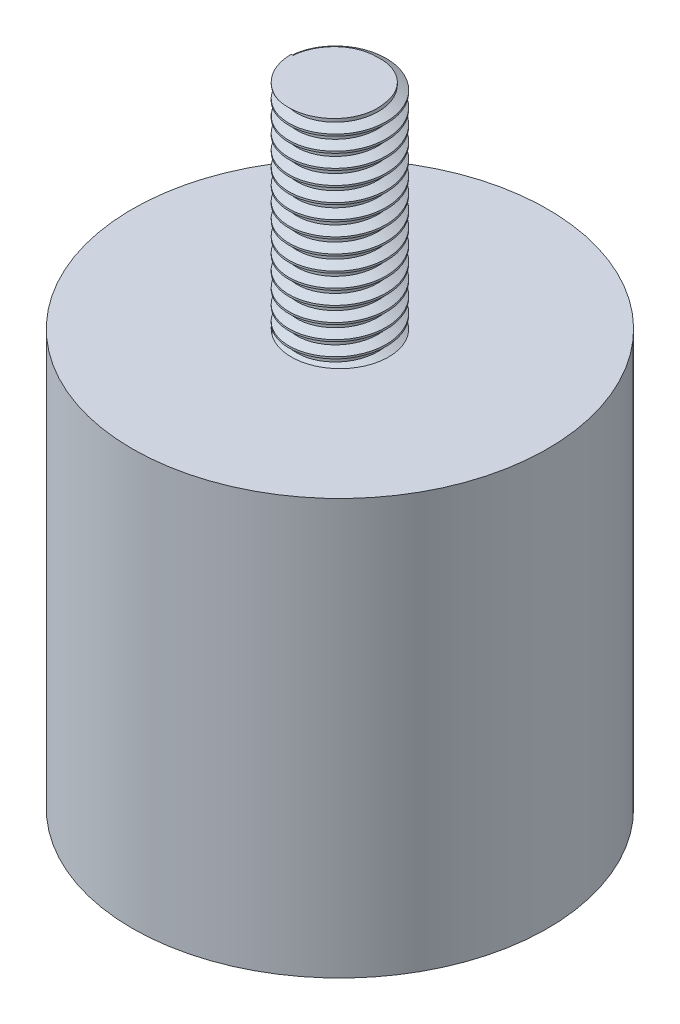
from build123d import *

# Parameters (mm, degrees)
IZIM2_W                     = 17.5
IZIM2_H                     = 35
IZIM2_W_2                   = 4.1
IZIM2_H_2                   = 18
DI_1_PITCH                  = 1.25
M8_DI_LI_DELIK1_D           = 6.8
M8_DI_LI_DELIK1_DEPTH       = 15
M8_DI_LI_DELIK1_CSINK_D     = 8.05
M8_DI_LI_DELIK1_CSINK_ANGLE = 90
M8_DI_LI_DELIK1_TIP         = 2.042926105


with BuildPart() as part:
    # Çizim2 → Döndür1 (revolve)
    with BuildSketch(Plane.XY, mode=Mode.PRIVATE) as d_nd_r1_sk:
        with Locations((-8.75, 0)):
            Rectangle(IZIM2_W, IZIM2_H)
        with Locations((-2.05, 26.5)):
            Rectangle(IZIM2_W_2, IZIM2_H_2)
    revolve(d_nd_r1_sk.sketch.rotate(Axis((0, 17.5, 0), (0, -1, 0)), 270), axis=Axis((0, 17.5, 0), (0, -1, 0)))

    # Diş1: the profile of Diş Profili1 profile screwed along a right-hand helix of 15.2 turns, 8 arcs to a turn; built about Z, then put on its axis
    di_1_z = Axis((0, 0, 0), (0, 0, 1))
    di_1_corners = [(4.1003, 0, -0.000173205), (4.1003, 0, 1.093923202), (3.423417656, 0, 0.703124998), (3.423417656, 0, 0.390624998)]
    with BuildLine(mode=Mode.PRIVATE) as di_1_profile:
        Line(di_1_corners[0], di_1_corners[1])
        Line(di_1_corners[1], di_1_corners[2])
        Line(di_1_corners[2], di_1_corners[3])
        Line(di_1_corners[3], di_1_corners[0])
    di_1_cap = Face(di_1_profile.wire())
    di_1_turn_angles = [0, 22.5, 45, 67.5, 90, 112.5, 135, 157.5, 180, 202.5, 225, 247.5, 270, 292.5, 315, 337.5, 360]
    di_1_turn_weights = [1, 0.9238795325112867, 1, 0.9238795325112867, 1, 0.9238795325112867, 1, 0.9238795325112867, 1, 0.9238795325112867, 1, 0.9238795325112867, 1, 0.9238795325112867, 1, 0.9238795325112867, 1]
    di_1_turn_rails = [Edge.make_bspline([Vector(p[0], p[1], 0).rotate(di_1_z, di_1_turn_angles[k]) / di_1_turn_weights[k] + Vector(0, 0, p[2] + DI_1_PITCH * di_1_turn_angles[k] / 360) for k in range(17)], [0, 0, 0, 1, 1, 2, 2, 3, 3, 4, 4, 5, 5, 6, 6, 7, 7, 8, 8, 8], 2, di_1_turn_weights) for p in di_1_corners]
    di_1_turn_sides = [Face.make_surface_from_curves(di_1_turn_rails[p[0]], di_1_turn_rails[p[1]]) for p in [(0, 1), (1, 2), (2, 3), (3, 0)]]
    di_1_last_angles = [5400, 5422.5, 5445, 5458.5, 5472]
    di_1_last_weights = [1, 0.9238795325112867, 1, 0.9723699203976748, 1]
    di_1_last_rails = [Edge.make_bspline([Vector(p[0], p[1], 0).rotate(di_1_z, di_1_last_angles[k]) / di_1_last_weights[k] + Vector(0, 0, p[2] + DI_1_PITCH * di_1_last_angles[k] / 360) for k in range(5)], [0, 0, 0, 1, 1, 2, 2, 2], 2, di_1_last_weights) for p in di_1_corners]
    di_1_last_sides = [Face.make_surface_from_curves(di_1_last_rails[p[0]], di_1_last_rails[p[1]]) for p in [(0, 1), (1, 2), (2, 3), (3, 0)]]
    di_1 = Plane(origin=(0, 36.5, 0), x_dir=(-1, 0, 0), z_dir=(0, -1, 0)) * Solid(Shell([*[p.moved(Location((0, 0, DI_1_PITCH * i))) for i in range(15) for p in di_1_turn_sides], *di_1_last_sides, di_1_cap, di_1_cap.rotate(di_1_z, 5472).moved(Location((0, 0, DI_1_PITCH * 5472 / 360)))]))
    add(di_1, mode=Mode.SUBTRACT)

    # M8 Dişli Delik1
    with Locations(Plane(origin=(0, -17.5, 0), x_dir=(-1, 0, 0), z_dir=(0, -1, 0))):
        with Locations((0, 0)):
            CounterSinkHole(M8_DI_LI_DELIK1_D / 2, M8_DI_LI_DELIK1_CSINK_D / 2, depth=M8_DI_LI_DELIK1_DEPTH, counter_sink_angle=M8_DI_LI_DELIK1_CSINK_ANGLE)
            with Locations((0, 0, -(M8_DI_LI_DELIK1_DEPTH + M8_DI_LI_DELIK1_TIP / 2))):  # 118° drill point
                Cone(0, M8_DI_LI_DELIK1_D / 2, M8_DI_LI_DELIK1_TIP, mode=Mode.SUBTRACT)


solid = part.part
